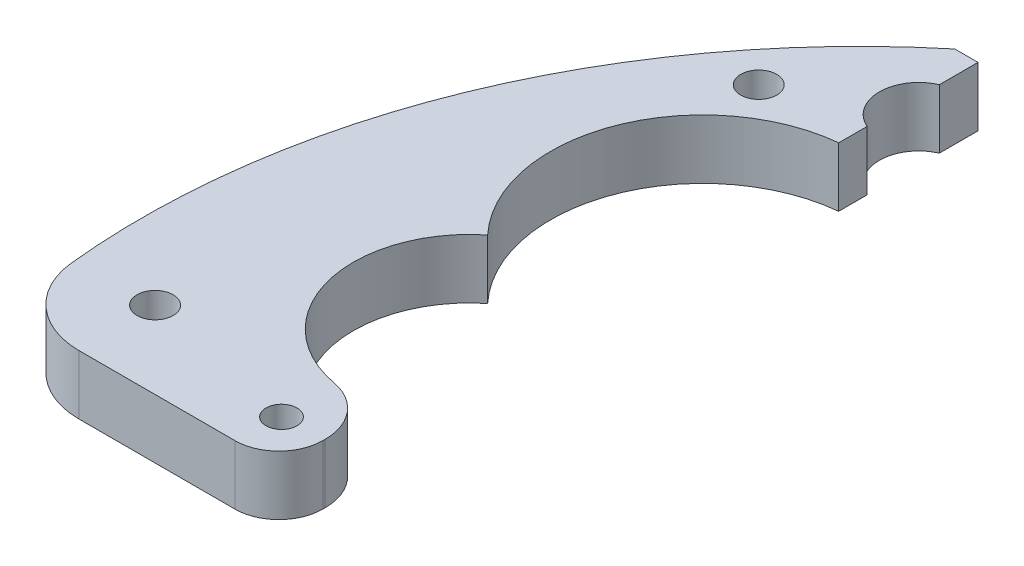
from build123d import *

# Parameters (mm, degrees)
BOSS_EXTRUDE1_DEPTH = 5.842
CUT_EXTRUDE1_DEPTH  = 77.930082101
CUT_EXTRUDE2_DEPTH  = 77.930082101
SKETCH8_R           = 11.43
CUT_EXTRUDE3_DEPTH  = 77.930082101
FILLET1_R           = 7.874
FILLET2_R           = 4.318
FILLET4_R           = 5.334
SKETCH9_R           = 1.774805699
CUT_EXTRUDE4_DEPTH  = 77.930082101
SKETCH10_R          = 1.524
CUT_EXTRUDE5_DEPTH  = 77.930082101
SKETCH11_R          = 1.778
CUT_EXTRUDE6_DEPTH  = 77.930082101


with BuildPart() as part:
    # Sketch1 → Boss-Extrude1 (new body)
    with BuildSketch(Plane(origin=(0, 0, 0), x_dir=(1, 0, 0), z_dir=(0, 1, 0))):
        with BuildLine():
            Line((30.379802604, 69.40499916), (32.665802604, 69.40499916))
            Line((32.665802604, 69.40499916), (32.665802604, 0.57099916))
            Line((32.665802604, 0.57099916), (6.249802604, 0.57099916))
            ThreePointArc((6.249802604, 0.57099916), (8.73869024, 38.344938918), (30.379802604, 69.40499916))
        make_face()
    extrude(amount=BOSS_EXTRUDE1_DEPTH)

    # Sketch2 → Cut-Extrude1 (cut, through all)
    with BuildSketch(Plane(origin=(0, 5.842, 0), x_dir=(1, 0, 0), z_dir=(0, 1, 0))):
        with BuildLine():
            Line((32.665802604, 65.59499916), (32.665802604, 58.48299916))
            ThreePointArc((32.665802604, 58.48299916), (30.320989866, 62.03899916), (32.665802604, 65.59499916))
        make_face()
    extrude(amount=-CUT_EXTRUDE1_DEPTH, mode=Mode.SUBTRACT)

    # Sketch7 → Cut-Extrude2 (cut, through all)
    with BuildSketch(Plane(origin=(0, 5.842, 0), x_dir=(1, 0, 0), z_dir=(0, 1, 0))):
        with BuildLine():
            Line((32.665802604, 55.68899916), (32.665802604, 25.872384999))
            ThreePointArc((32.665802604, 25.872384999), (19.203802604, 40.780692079), (32.665802604, 55.68899916))
        make_face()
    extrude(amount=-CUT_EXTRUDE2_DEPTH, mode=Mode.SUBTRACT)

    # Sketch8 → Cut-Extrude3 (cut, through all)
    with BuildSketch(Plane(origin=(0, 5.842, 0), x_dir=(1, 0, 0), z_dir=(0, 1, 0))):
        with Locations((30.379802604, 21.612613445)):
            Circle(SKETCH8_R)
    extrude(amount=-CUT_EXTRUDE3_DEPTH, mode=Mode.SUBTRACT)

    # Fillet1
    fillet1_edges = [part.edges().sort_by_distance(p)[0] for p in [
        (6.249802604, 2.921, -0.57099916),
    ]]
    fillet(fillet1_edges, radius=FILLET1_R)

    # Fillet2
    fillet2_edges = [part.edges().sort_by_distance(p)[0] for p in [
        (32.665802604, 2.921, -0.57099916),
    ]]
    fillet(fillet2_edges, radius=FILLET2_R)

    # Fillet4
    fillet4_edges = [part.edges().sort_by_distance(p)[0] for p in [
        (32.665802604, 2.921, -10.413546341),
    ]]
    fillet(fillet4_edges, radius=FILLET4_R)

    # Sketch9 → Cut-Extrude4 (cut, through all)
    with BuildSketch(Plane(origin=(0, 5.842, 0), x_dir=(1, 0, 0), z_dir=(0, 1, 0))):
        with Locations((23.775802604, 56.70499916)):
            Circle(SKETCH9_R)
    extrude(amount=-CUT_EXTRUDE4_DEPTH, mode=Mode.SUBTRACT)

    # Sketch10 → Cut-Extrude5 (cut, through all)
    with BuildSketch(Plane(origin=(0, 5.842, 0), x_dir=(1, 0, 0), z_dir=(0, 1, 0))):
        with Locations((28.601802604, 4.88899916)):
            Circle(SKETCH10_R)
    extrude(amount=-CUT_EXTRUDE5_DEPTH, mode=Mode.SUBTRACT)

    # Sketch11 → Cut-Extrude6 (cut, through all)
    with BuildSketch(Plane(origin=(0, 5.842, 0), x_dir=(1, 0, 0), z_dir=(0, 1, 0))):
        with Locations((12.853802604, 8.19099916)):
            Circle(SKETCH11_R)
    extrude(amount=-CUT_EXTRUDE6_DEPTH, mode=Mode.SUBTRACT)


solid = part.part
